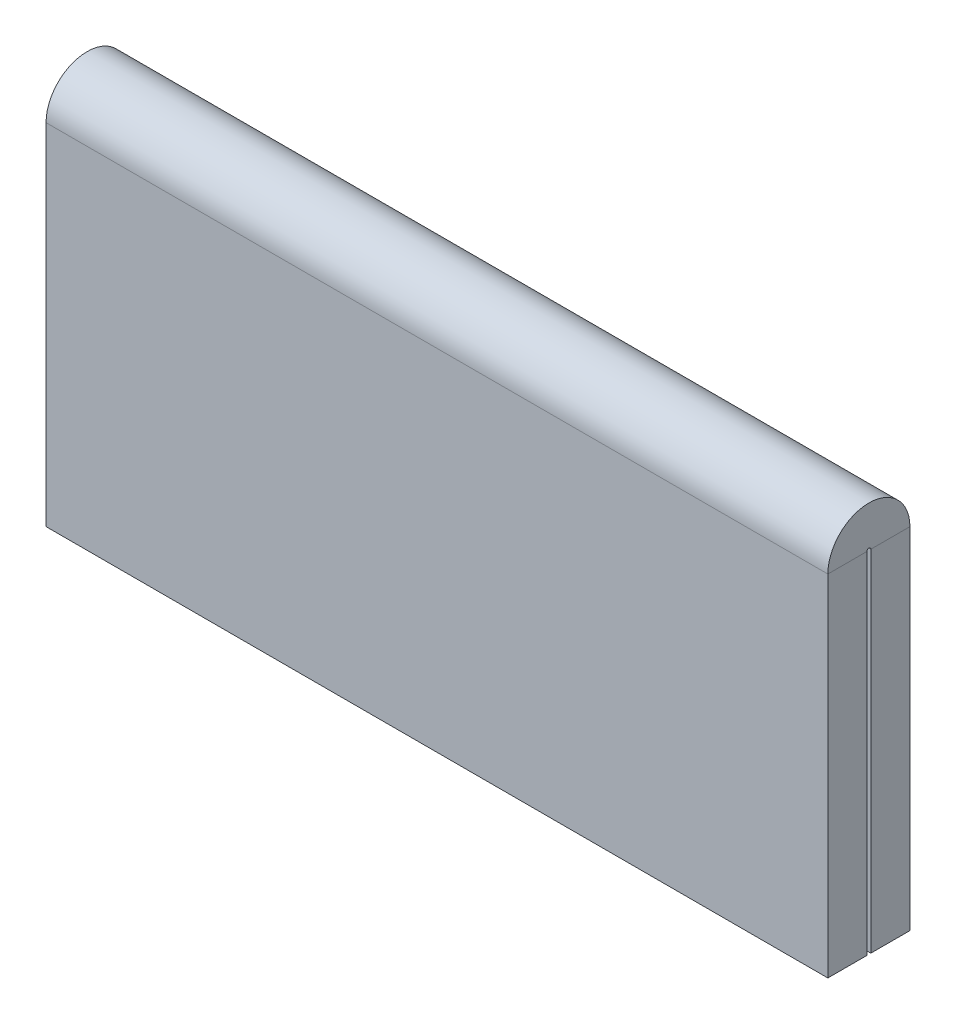
from build123d import *

# Parameters (mm, degrees)
SKETCH_1_W         = 20
SKETCH_1_H         = 10
BASEPLATE_DEPTH    = 1
HEM_CLOSED_DEPTH   = 20
HEM_CLOSED_2_DEPTH = 20


# Read off the part's stored shape, not the designer's step: Hem_closed
# Sheet-metal steps are written as plain solids
with BuildPart() as part:
    # Sketch 1 → BasePlate (new body)
    with BuildSketch(Plane.XY):
        with Locations((10, 5)):
            Rectangle(SKETCH_1_W, SKETCH_1_H)
    extrude(amount=-BASEPLATE_DEPTH)

    # Hem_closed outline → Hem_closed (cut)
    with BuildSketch(Plane.YZ):
        with BuildLine():
            Line((10, 0), (9.998808848, 0))
            ThreePointArc((9.998808848, 0), (9.674568837, -0.709934208), (8.95, -1))
            Line((8.95, -1), (10, -1))
            Line((10, -1), (10, 0))
        make_face()
    extrude(amount=HEM_CLOSED_DEPTH, mode=Mode.SUBTRACT)

    # Hem_closed 2 outline → Hem_closed 2 (add)
    with BuildSketch(Plane.YZ):
        with BuildLine():
            Line((0, 1.1), (0, 0.1))
            Line((0, 0.1), (8.95, 0.1))
            ThreePointArc((8.95, 0.1), (9, 0.05), (8.95, 0))
            Line((8.95, 0), (9.998808848, 0))
            ThreePointArc((9.998808848, 0), (9.709934208, 0.774568837), (8.95, 1.1))
            Line((8.95, 1.1), (0, 1.1))
        make_face()
    extrude(amount=HEM_CLOSED_2_DEPTH)


solid = part.part
